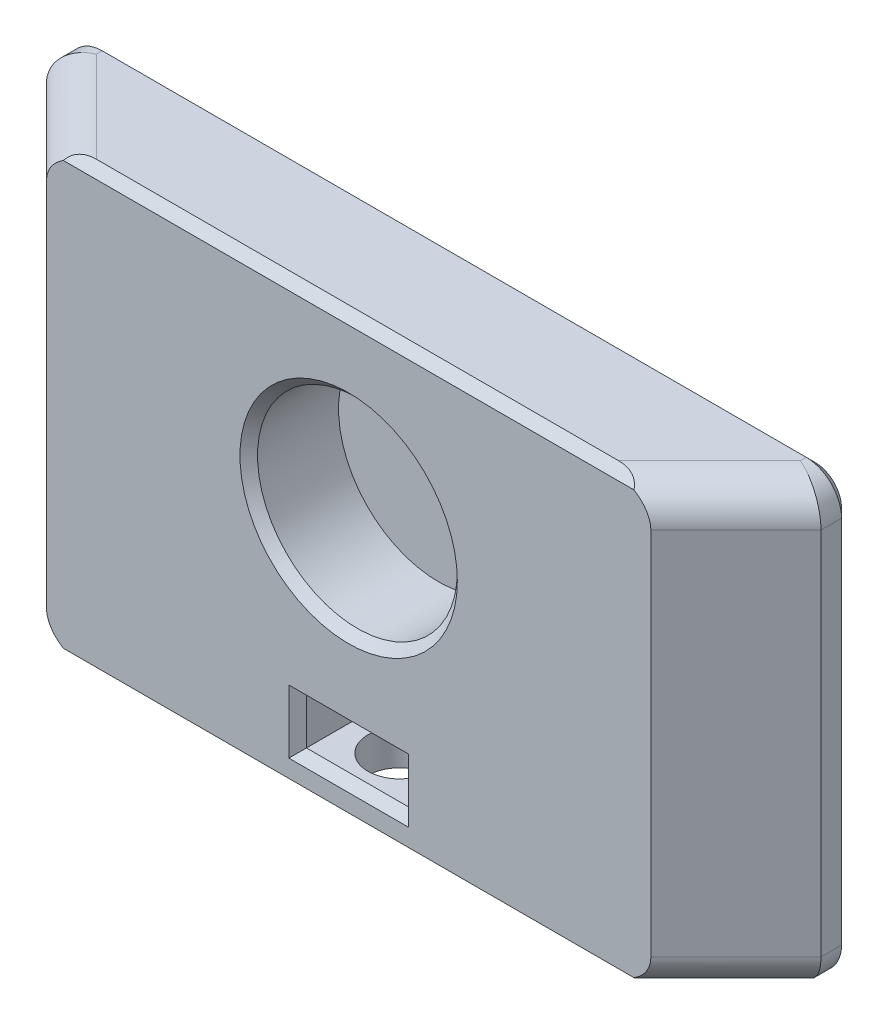
from build123d import *

# Parameters (mm, degrees)
SKIZZE1_W                            = 44
SKIZZE1_H                            = 25
AUFSATZ_LINEAR_AUSTRAGEN1_DEPTH      = 6.5
SKIZZE2_R                            = 5.675
SCHNITT_LINEAR_AUSTRAGEN1_DEPTH      = 5.1
VERRUNDUNG1_R                        = 2
SKIZZE8_W                            = 5.8
SKIZZE8_H                            = 2.6
SCHNITT_LINEAR_AUSTRAGEN5_DEPTH      = 4.5
SCHNITT_LINEAR_AUSTRAGEN6_DEPTH      = 2.6
SCHNITT_LINEAR_AUSTRAGEN7_DEPTH      = 31.698697041
SCHNITT_LINEAR_AUSTRAGEN7_DEPTH_BACK = 4.1
SCHNITT_LINEAR_AUSTRAGEN8_DEPTH      = 34.930075155
FASE1_SIZE                           = 0.5
VERRUNDUNG2_R                        = 2


with BuildPart() as part:
    # Skizze1 → Aufsatz-Linear austragen1 (new body)
    with BuildSketch(Plane.XY):
        with Locations((0, -2.5)):
            Rectangle(SKIZZE1_W, SKIZZE1_H)
    extrude(amount=AUFSATZ_LINEAR_AUSTRAGEN1_DEPTH)

    # Skizze2 → Schnitt-Linear austragen1 (cut)
    with BuildSketch(Plane.XY.offset(6.5)):
        Circle(SKIZZE2_R)
    extrude(amount=-SCHNITT_LINEAR_AUSTRAGEN1_DEPTH, mode=Mode.SUBTRACT)

    # Verrundung1
    verrundung1_edges = [part.edges().sort_by_distance(p)[0] for p in [
        (-22, 10, 3.25),
        (22, 10, 3.25),
        (22, -15, 3.25),
        (-22, -15, 3.25),
    ]]
    fillet(verrundung1_edges, radius=VERRUNDUNG1_R)

    # Skizze8 → Schnitt-Linear austragen5 (cut)
    with BuildSketch(Plane.XY.offset(6.5)):
        with Locations((0, -11.7)):
            Rectangle(SKIZZE8_W, SKIZZE8_H)
    extrude(amount=-SCHNITT_LINEAR_AUSTRAGEN5_DEPTH, mode=Mode.SUBTRACT)

    # Skizze9 → Schnitt-Linear austragen6 (cut)
    with BuildSketch(Plane.XZ.offset(10.4)):
        with BuildLine():
            Line((-0.820441954, 2), (-2.775, 2))
            Line((-2.775, 2), (0, 0.397853003))
            Line((0, 0.397853003), (2.775, 2))
            Line((2.775, 2), (0.820441954, 2))
            ThreePointArc((0.820441954, 2), (0, 1.802146997), (-0.820441954, 2))
        make_face()
        with BuildLine():
            ThreePointArc((1.8, 3.602146997), (-0.938936761, 5.137854573), (-0.820441954, 2))
            Line((-0.820441954, 2), (0.820441954, 2))
            ThreePointArc((0.820441954, 2), (1.535707576, 2.663210236), (1.8, 3.602146997))
        make_face()
        with BuildLine():
            Line((0.820441954, 2), (-0.820441954, 2))
            ThreePointArc((-0.820441954, 2), (0, 1.802146997), (0.820441954, 2))
        make_face()
    extrude(amount=SCHNITT_LINEAR_AUSTRAGEN6_DEPTH, mode=Mode.SUBTRACT)

    # Skizze9<3> → Schnitt-Linear austragen7 (cut, two sides: drawn at the far end of the back side and taken through both)
    with BuildSketch(Plane.XZ.offset(10.4).offset(-SCHNITT_LINEAR_AUSTRAGEN7_DEPTH_BACK)):
        with BuildLine():
            ThreePointArc((1.8, 3.602146997), (-0.938936761, 5.137854573), (-0.820441954, 2))
            Line((-0.820441954, 2), (0.820441954, 2))
            ThreePointArc((0.820441954, 2), (1.535707576, 2.663210236), (1.8, 3.602146997))
        make_face()
        with BuildLine():
            Line((0.820441954, 2), (-0.820441954, 2))
            ThreePointArc((-0.820441954, 2), (0, 1.802146997), (0.820441954, 2))
        make_face()
    extrude(amount=SCHNITT_LINEAR_AUSTRAGEN7_DEPTH + SCHNITT_LINEAR_AUSTRAGEN7_DEPTH_BACK, mode=Mode.SUBTRACT)

    # Skizze10 → Schnitt-Linear austragen8 (cut, through all)
    with BuildSketch(Plane.XZ.offset(15)):
        Polygon((-22, 1.667157288), (-17.167157288, 6.5), (-22, 6.5), align=None)
        Polygon((22, 1.667157288), (22, 6.5), (17.167157288, 6.5), align=None)
    extrude(amount=-SCHNITT_LINEAR_AUSTRAGEN8_DEPTH, mode=Mode.SUBTRACT)

    # Fase1
    fase1_edges = [part.edges().sort_by_distance(p)[0] for p in [
        (-5.675, 0, 6.5),
        (0, 10, 0),
        (-22, -2.5, 0),
        (22, -2.5, 0),
        (0, -15, 0),
        (-21.414213562, -14.414213562, 0),
        (-21.414213562, 9.414213562, 0),
        (21.414213562, -14.414213562, 0),
        (21.414213562, 9.414213562, 0),
        (2.9, -11.7, 6.5),
        (0, -10.4, 6.5),
        (-2.9, -11.7, 6.5),
        (0, -13, 6.5),
        (0, 10, 6.5),
        (0, -15, 6.5),
    ]]
    chamfer(fase1_edges, length=FASE1_SIZE)

    # Verrundung2
    # the kernel refuses this fillet: 2 mm, written as the material it takes off along each edge
    with BuildSketch(Plane(origin=(-23.535533906, 10, 0.131623382), x_dir=(0.7071067811865477, 0, -0.7071067811865477), z_dir=(0.7071067811865476, 0, 0.7071067811865476)), Plane(origin=(14.131623382, 10, 9.535533906), x_dir=(-0.7071067811865476, 0, -0.7071067811865476), z_dir=(0.7071067811865476, 0, -0.7071067811865475)), Plane(origin=(14.131623382, -15, 9.535533906), x_dir=(0, 1, 0), z_dir=(0.7071067811865476, 0, -0.7071067811865475)), Plane(origin=(-23.535533906, -15, 0.131623382), x_dir=(0, 1, 0), z_dir=(0.7071067811865476, 0, 0.7071067811865476))) as verrundung2_piece_1:
        with BuildLine():
            CenterArc((VERRUNDUNG2_R, -VERRUNDUNG2_R), VERRUNDUNG2_R, 90, 90)
            Line((0, -VERRUNDUNG2_R), (0, 0))
            Line((0, 0), (VERRUNDUNG2_R, 0))
        make_face()
    extrude(amount=13.299137803, mode=Mode.SUBTRACT)


solid = part.part
